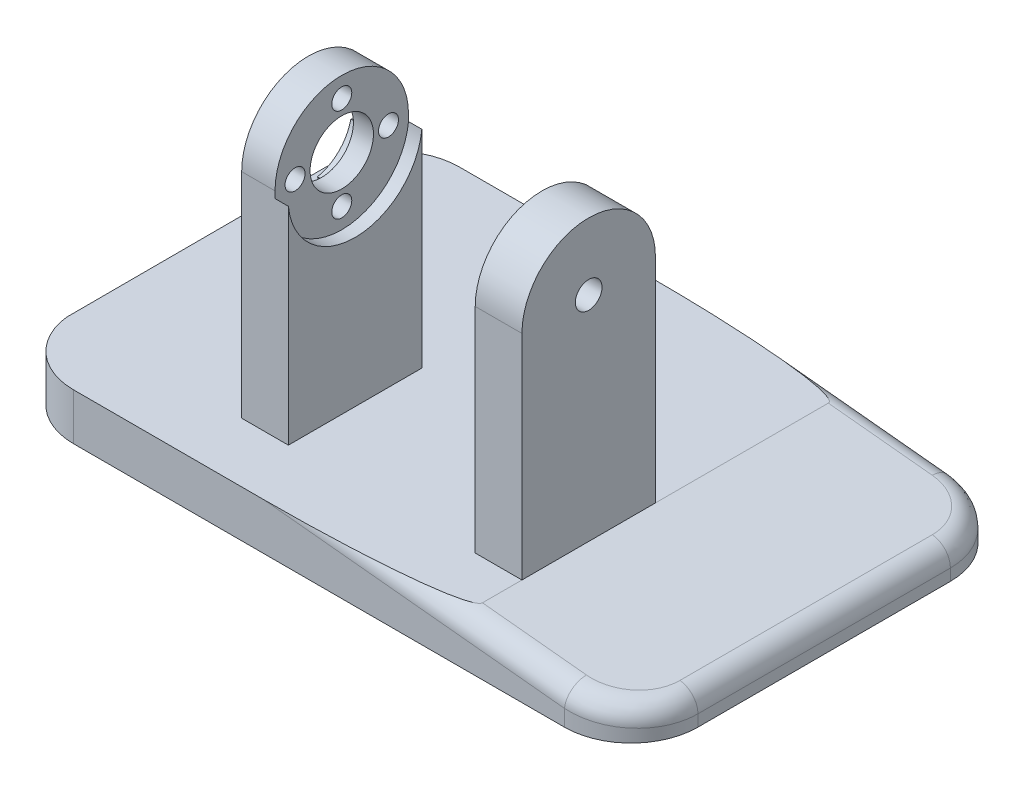
from build123d import *

# Parameters (mm, degrees)
SKETCH1_W                = 41
SKETCH1_H                = 20
BOSS_EXTRUDE2_DEPTH      = 7
SKETCH3_R                = 10.05
CUT_EXTRUDE8_DEPTH       = 2
SKETCH4_R                = 1.5
SKETCH4_R_2              = 3
CUT_EXTRUDE9_DEPTH       = 29
SKETCH5_W                = 6
SKETCH5_H                = 20
SKETCH5_W_2              = 7
BOSS_EXTRUDE3_DEPTH      = 36
CUT_EXTRUDE10_DEPTH      = 36
SKETCH7_R                = 2
CUT_EXTRUDE11_DEPTH      = 51
SKETCH8_R                = 10.05
CUT_EXTRUDE12_DEPTH      = 2
SKETCH9_R                = 4.75
CUT_EXTRUDE13_DEPTH      = 3.25
SKETCH10_R               = 6.5
CUT_EXTRUDE14_DEPTH      = 2
CUT_EXTRUDE15_DEPTH      = 14
CUT_EXTRUDE15_DEPTH_BACK = 10
SKETCH12_R               = 1.5
CUT_EXTRUDE16_DEPTH      = 10
CUT_EXTRUDE17_DEPTH      = 10
MIRROR1_START            = 5
MIRROR1_DEPTH            = 2
MIRROR1_2_DEPTH          = 7
MIRROR1_3_DEPTH          = 5
CUT_EXTRUDE18_DEPTH      = 10
CUT_EXTRUDE18_DEPTH_BACK = 10
BOSS_EXTRUDE4_START      = 16
BOSS_EXTRUDE4_DEPTH      = 16
BOSS_EXTRUDE6_START      = -21
SKETCH16_W               = 28
SKETCH16_H               = 20
SKETCH16_R               = 1.5
SKETCH16_R_2             = 3
BOSS_EXTRUDE6_DEPTH      = 21
SKETCH18_W               = 28
SKETCH18_H               = 20
CUT_EXTRUDE21_DEPTH      = 16
CROQUIS2_R               = 3
CORTAR_EXTRUIR1_DEPTH    = 3
CROQUIS3_R               = 4
CORTAR_EXTRUIR2_DEPTH    = 0.3
SALIENTE_EXTRUIR1_DEPTH  = 1
CROQUIS5_R               = 2
CORTAR_EXTRUIR3_DEPTH    = 1
SALIENTE_EXTRUIR2_DEPTH  = 7
CORTAR_EXTRUIR4_DEPTH    = 76
REDONDEO1_R              = 3


# Read off the part's stored shape, not the designer's step: Mirror1
with BuildPart() as part:
    # Sketch1 → Boss-Extrude2 (new body)
    with BuildSketch(Plane(origin=(0, 0, 0), x_dir=(1, 0, 0), z_dir=(0, 1, 0))):
        with Locations((20.5, 10)):
            Rectangle(SKETCH1_W, SKETCH1_H)
    extrude(amount=BOSS_EXTRUDE2_DEPTH)

    # Sketch3 → Cut-Extrude8 (cut)
    with BuildSketch(Plane.XZ):
        with Locations((20.5, -10)):
            Circle(SKETCH3_R)
    extrude(amount=-CUT_EXTRUDE8_DEPTH, mode=Mode.SUBTRACT)

    # Sketch4 → Cut-Extrude9 (cut)
    with BuildSketch(Plane.XZ.offset(-2)):
        with Locations(Location((20.5, -2.95, 0), (0, 0, 270))):
            Circle(SKETCH4_R)
        with Locations(Location((27.55, -10, 0), (0, 0, 270))):
            Circle(SKETCH4_R)
        with Locations(Location((20.5, -17.05, 0), (0, 0, 270))):
            Circle(SKETCH4_R)
        with Locations(Location((13.45, -10, 0), (0, 0, 270))):
            Circle(SKETCH4_R)
        with Locations(Location((20.5, -10, 0), (0, 0, 270))):
            Circle(SKETCH4_R_2)
    extrude(amount=-CUT_EXTRUDE9_DEPTH, mode=Mode.SUBTRACT)

    # Sketch5 → Boss-Extrude3 (add)
    with BuildSketch(Plane(origin=(0, 7, 0), x_dir=(1, 0, 0), z_dir=(0, 1, 0))):
        with Locations((38, 10)):
            Rectangle(SKETCH5_W, SKETCH5_H)
        with Locations((3.5, 10)):
            Rectangle(SKETCH5_W_2, SKETCH5_H)
    extrude(amount=BOSS_EXTRUDE3_DEPTH)

    # Sketch6 → Cut-Extrude10 (cut)
    with BuildSketch(Plane.XY):
        Polygon((0, 33), (71.43253461, 33), (71.43253461, 55.308458538), (-13.966778087, 55.308458538), align=None)
    extrude(amount=-CUT_EXTRUDE10_DEPTH, mode=Mode.SUBTRACT)

    # Sketch7 → Cut-Extrude11 (cut)
    with BuildSketch(Plane.ZY):
        with Locations((-10, 23)):
            Circle(SKETCH7_R)
    extrude(amount=-CUT_EXTRUDE11_DEPTH, mode=Mode.SUBTRACT)

    # Sketch8 → Cut-Extrude12 (cut)
    with BuildSketch(Plane.ZY):
        with Locations((-10, 23)):
            Circle(SKETCH8_R)
    extrude(amount=-CUT_EXTRUDE12_DEPTH, mode=Mode.SUBTRACT)

    # Sketch9 → Cut-Extrude13 (cut)
    with BuildSketch(Plane.ZY.offset(-2)):
        with Locations((-10, 23)):
            Circle(SKETCH9_R)
    extrude(amount=-CUT_EXTRUDE13_DEPTH, mode=Mode.SUBTRACT)

    # Sketch10 → Cut-Extrude14 (cut)
    with BuildSketch(Plane(origin=(7, 0, 0), x_dir=(0, 0, -1), z_dir=(1, 0, 0))):
        with Locations((10, 23)):
            Circle(SKETCH10_R)
    extrude(amount=-CUT_EXTRUDE14_DEPTH, mode=Mode.SUBTRACT)

    # Sketch11 → Cut-Extrude15 (cut, two sides: drawn at the far end of the back side and taken through both)
    with BuildSketch(Plane.ZY.offset(-2).offset(-CUT_EXTRUDE15_DEPTH_BACK)):
        with BuildLine():
            Line((0, 23), (15.490351621, 23))
            Line((15.490351621, 23), (12.295560885, 45.157965149))
            Line((12.295560885, 45.157965149), (-24.464924867, 45.157965149))
            Line((-24.464924867, 45.157965149), (-29.902866546, 24.493786768))
            Line((-29.902866546, 24.493786768), (-20, 23))
            ThreePointArc((-20, 23), (-10, 33), (0, 23))
        make_face()
    extrude(amount=CUT_EXTRUDE15_DEPTH + CUT_EXTRUDE15_DEPTH_BACK, mode=Mode.SUBTRACT)

    # Sketch12 → Cut-Extrude16 (cut)
    with BuildSketch(Plane.ZY.offset(-2)):
        with Locations((-10, 30)):
            Circle(SKETCH12_R)
        with Locations((-3, 23)):
            Circle(SKETCH12_R)
        with Locations((-10, 16)):
            Circle(SKETCH12_R)
        with Locations((-17, 23)):
            Circle(SKETCH12_R)
    extrude(amount=-CUT_EXTRUDE16_DEPTH, mode=Mode.SUBTRACT)

    # Sketch13 → Cut-Extrude17 (cut)
    with BuildSketch(Plane(origin=(41, 0, 0), x_dir=(0, 0, -1), z_dir=(1, 0, 0))):
        with BuildLine():
            Line((20, 23), (26.17535893, 23))
            Line((26.17535893, 23), (24.098367316, 34.532076054))
            Line((24.098367316, 34.532076054), (-4.476002155, 34.532076054))
            Line((-4.476002155, 34.532076054), (-5.608906672, 23))
            Line((-5.608906672, 23), (0, 23))
            ThreePointArc((0, 23), (10, 33), (20, 23))
        make_face()
    extrude(amount=-CUT_EXTRUDE17_DEPTH, mode=Mode.SUBTRACT)

    # Mirror1 outline → Mirror1 (cut)
    with BuildSketch(Plane.YZ.offset(MIRROR1_START)):
        with BuildLine():
            Line((23, 0), (21.99875078, 0))
            ThreePointArc((21.99875078, 0), (12.95, -10), (21.99875078, -20))
            Line((21.99875078, -20), (23, -20))
            ThreePointArc((23, -20), (33, -10), (23, 0))
        make_face()
        with BuildLine():
            ThreePointArc((24.355261854, -16.357142857), (23, -18.5), (21.644738146, -16.357142857))
            ThreePointArc((21.644738146, -16.357142857), (18.403805922, -14.596194078), (16.642857143, -11.355261854))
            ThreePointArc((16.642857143, -11.355261854), (14.5, -10), (16.642857143, -8.644738146))
            ThreePointArc((16.642857143, -8.644738146), (18.403805922, -5.403805922), (21.644738146, -3.642857143))
            ThreePointArc((21.644738146, -3.642857143), (23, -1.5), (24.355261854, -3.642857143))
            ThreePointArc((24.355261854, -3.642857143), (27.596194078, -5.403805922), (29.357142857, -8.644738146))
            ThreePointArc((29.357142857, -8.644738146), (31.5, -10), (29.357142857, -11.355261854))
            ThreePointArc((29.357142857, -11.355261854), (27.596194078, -14.596194078), (24.355261854, -16.357142857))
        make_face(mode=Mode.SUBTRACT)
    extrude(amount=MIRROR1_DEPTH, mode=Mode.SUBTRACT)



with BuildPart() as body_2:
    # Mirror1 2 outline → Mirror1 2 (new body)
    with BuildSketch(Plane.YZ):
        with BuildLine():
            Line((43, 0), (24.00124922, 0))
            ThreePointArc((24.00124922, 0), (33.05, -10), (24.00124922, -20))
            Line((24.00124922, -20), (43, -20))
            Line((43, -20), (43, 0))
        make_face()
    extrude(amount=MIRROR1_2_DEPTH)


with BuildPart() as part_1:
    add(part.part)

    add(body_2.part)  # Mirror1 3 merges body 2
    # Mirror1 3 outline → Mirror1 3 (add)
    with BuildSketch(Plane.YZ):
        with BuildLine():
            ThreePointArc((21.99875078, 0), (12.95, -10), (21.99875078, -20))
            Line((21.99875078, -20), (24.00124922, -20))
            ThreePointArc((24.00124922, -20), (33.05, -10), (24.00124922, 0))
            Line((24.00124922, 0), (21.99875078, 0))
        make_face()
        with BuildLine():
            ThreePointArc((24.355261854, -16.357142857), (23, -18.5), (21.644738146, -16.357142857))
            ThreePointArc((21.644738146, -16.357142857), (18.403805922, -14.596194078), (16.642857143, -11.355261854))
            ThreePointArc((16.642857143, -11.355261854), (14.5, -10), (16.642857143, -8.644738146))
            ThreePointArc((16.642857143, -8.644738146), (18.403805922, -5.403805922), (21.644738146, -3.642857143))
            ThreePointArc((21.644738146, -3.642857143), (23, -1.5), (24.355261854, -3.642857143))
            ThreePointArc((24.355261854, -3.642857143), (27.596194078, -5.403805922), (29.357142857, -8.644738146))
            ThreePointArc((29.357142857, -8.644738146), (31.5, -10), (29.357142857, -11.355261854))
            ThreePointArc((29.357142857, -11.355261854), (27.596194078, -14.596194078), (24.355261854, -16.357142857))
        make_face(mode=Mode.SUBTRACT)
    extrude(amount=MIRROR1_3_DEPTH)

    # Sketch14 → Cut-Extrude18 (cut, two sides: drawn at the far end of the back side and taken through both)
    with BuildSketch(Plane(origin=(5, 0, 0), x_dir=(0, 0, -1), z_dir=(1, 0, 0)).offset(-CUT_EXTRUDE18_DEPTH_BACK)):
        with BuildLine():
            Line((20, 23), (39.442144398, 23))
            Line((39.442144398, 23), (24.053498228, 52.618460363))
            Line((24.053498228, 52.618460363), (-15.863160605, 48.721271778))
            Line((-15.863160605, 48.721271778), (-25.901373625, 22.149531431))
            Line((-25.901373625, 22.149531431), (0, 23))
            ThreePointArc((0, 23), (10, 33), (20, 23))
        make_face()
    extrude(amount=CUT_EXTRUDE18_DEPTH + CUT_EXTRUDE18_DEPTH_BACK, mode=Mode.SUBTRACT)

    # Sketch15 → Boss-Extrude4 (add)
    with BuildSketch(Plane.XZ.offset(BOSS_EXTRUDE4_START)):
        with BuildLine():
            Line((21.50124922, 0), (41, 0))
            Line((41, 0), (41, -20))
            Line((41, -20), (21.50124922, -20))
            ThreePointArc((21.50124922, -20), (30.55, -10), (21.50124922, 0))
        make_face()
        with BuildLine():
            Line((0, 0), (19.49875078, 0))
            ThreePointArc((19.49875078, 0), (10.45, -10), (19.49875078, -20))
            Line((19.49875078, -20), (0, -20))
            Line((0, -20), (0, 0))
        make_face()
    extrude(amount=-BOSS_EXTRUDE4_DEPTH)

    # Sketch16 → Boss-Extrude6 (add)
    with BuildSketch(Plane(origin=(0, 7, 0), x_dir=(1, 0, 0), z_dir=(0, 1, 0)).offset(BOSS_EXTRUDE6_START)):
        with Locations((21, 10)):
            Rectangle(SKETCH16_W, SKETCH16_H)
        with Locations(Location((27.55, 10, 0), (0, 0, 90))):
            Circle(SKETCH16_R, mode=Mode.SUBTRACT)
        with Locations(Location((20.5, 10, 0), (0, 0, 90))):
            Circle(SKETCH16_R_2, mode=Mode.SUBTRACT)
        with Locations(Location((13.45, 10, 0), (0, 0, 90))):
            Circle(SKETCH16_R, mode=Mode.SUBTRACT)
        with Locations(Location((20.5, 17.05, 0), (0, 0, 90))):
            Circle(SKETCH16_R, mode=Mode.SUBTRACT)
        with Locations(Location((20.5, 2.95, 0), (0, 0, 90))):
            Circle(SKETCH16_R, mode=Mode.SUBTRACT)
    extrude(amount=BOSS_EXTRUDE6_DEPTH)

    # Sketch18 → Cut-Extrude21 (cut)
    with BuildSketch(Plane(origin=(0, 7, 0), x_dir=(1, 0, 0), z_dir=(0, 1, 0))):
        with Locations((21, 10)):
            Rectangle(SKETCH18_W, SKETCH18_H)
    extrude(amount=-CUT_EXTRUDE21_DEPTH, mode=Mode.SUBTRACT)

    # Croquis2 → Cortar-Extruir1 (cut)
    with BuildSketch(Plane(origin=(0, -9, 0), x_dir=(1, 0, 0), z_dir=(0, 1, 0))):
        with Locations(Location((27.55, 10, 0), (0, 0, 270))):
            Circle(CROQUIS2_R)
        with Locations((20.5, 17.05)):
            Circle(CROQUIS2_R)
        with Locations(Location((13.45, 10, 0), (0, 0, 270))):
            Circle(CROQUIS2_R)
        with Locations((20.5, 2.95)):
            Circle(CROQUIS2_R)
    extrude(amount=-CORTAR_EXTRUIR1_DEPTH, mode=Mode.SUBTRACT)

    # Croquis3 → Cortar-Extruir2 (cut)
    with BuildSketch(Plane.ZY.offset(-35)):
        with Locations((-10, 23)):
            Circle(CROQUIS3_R)
    extrude(amount=-CORTAR_EXTRUIR2_DEPTH, mode=Mode.SUBTRACT)

    # Croquis4 → Saliente-Extruir1 (add)
    with BuildSketch(Plane(origin=(41, 0, 0), x_dir=(0, 0, -1), z_dir=(1, 0, 0))):
        with BuildLine():
            Line((20, -16), (20, 23))
            ThreePointArc((20, 23), (10, 33), (0, 23))
            Line((0, 23), (0, -16))
            Line((0, -16), (20, -16))
        make_face()
    extrude(amount=SALIENTE_EXTRUIR1_DEPTH)

    # Croquis5 → Cortar-Extruir3 (cut)
    with BuildSketch(Plane.ZY.offset(-41)):
        with Locations((-10, 23)):
            Circle(CROQUIS5_R)
    extrude(amount=-CORTAR_EXTRUIR3_DEPTH, mode=Mode.SUBTRACT)

    # Croquis6 → Saliente-Extruir2 (add)
    with BuildSketch(Plane(origin=(0, -9, 0), x_dir=(1, 0, 0), z_dir=(0, 1, 0))):
        with BuildLine():
            Line((57.285, 48.915), (-16.285, 48.915))
            ThreePointArc((-16.285, 48.915), (-23.356067812, 45.986067812), (-26.285, 38.915))
            Line((-26.285, 38.915), (-26.22596449, 0))
            ThreePointArc((-26.22596449, 0), (-22.961451153, -6.359796841), (-16.285, -8.915))
            Line((-16.285, -8.915), (57.285, -8.915))
            ThreePointArc((57.285, -8.915), (64.356067812, -5.986067812), (67.285, 1.085))
            Line((67.285, 1.085), (67.285, 38.915))
            ThreePointArc((67.285, 38.915), (64.356067812, 45.986067812), (57.285, 48.915))
        make_face()
    extrude(amount=-SALIENTE_EXTRUIR2_DEPTH)

    # Croquis8 → Cortar-Extruir4 (cut)
    with BuildSketch(Plane(origin=(0, 0, -48.915), x_dir=(-1, 0, 0), z_dir=(0, 0, -1))):
        Polygon((-42, -9), (-78.538129526, -12.692039661), (-74.698456834, 7.097042671), align=None)
    extrude(amount=-CORTAR_EXTRUIR4_DEPTH, mode=Mode.SUBTRACT)

    # Redondeo1
    redondeo1_edges = [part_1.edges().sort_by_distance(p)[0] for p in [
        (64.347083214, -11.258088156, -45.995041009),
        (49.6425, -9.772245692, 8.915),
        (64.347083214, -11.258088156, 5.995041009),
        (67.285, -11.554953525, -20),
        (49.6425, -9.772245692, -48.915),
    ]]
    fillet(redondeo1_edges, radius=REDONDEO1_R)


solid = part_1.part
